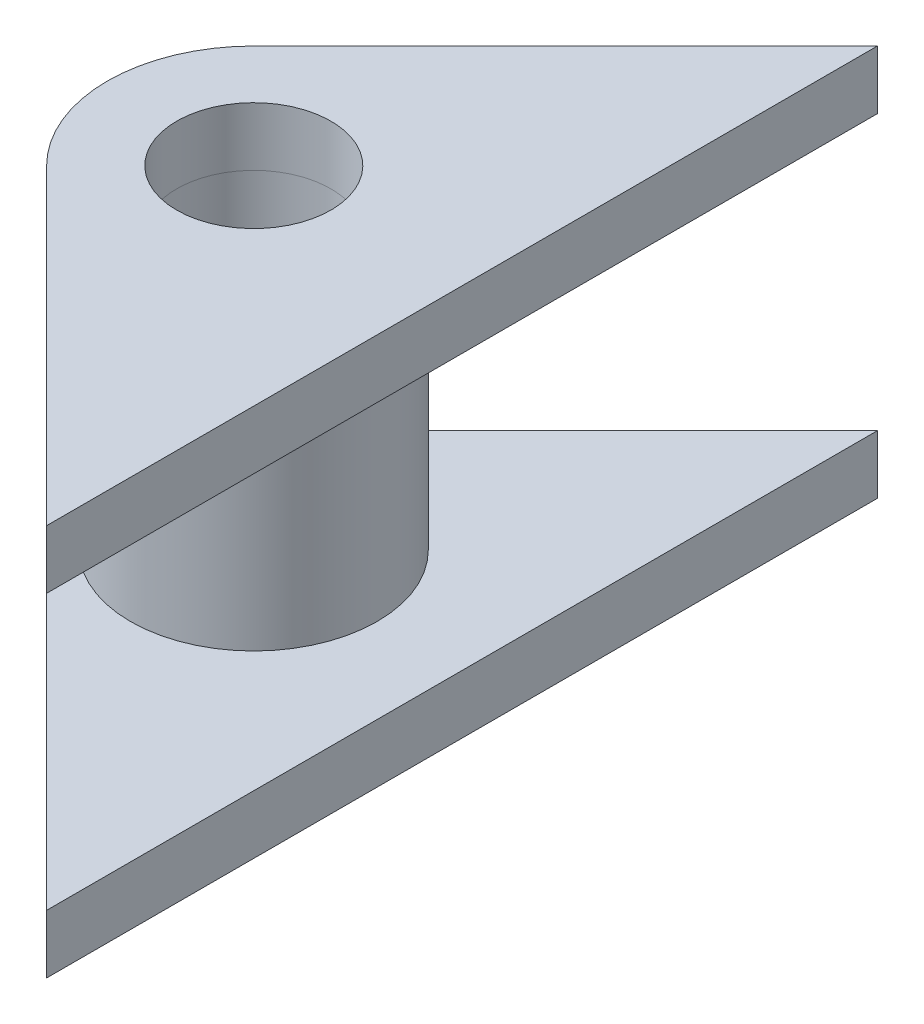
from build123d import *

# Parameters (mm, degrees)
BOSS_EXTRUDE1_START       = 12.7
SKETCH1_R                 = 5
BOSS_EXTRUDE1_DEPTH       = 3.8
BOSS_EXTRUDE2_START       = -12.7
SKETCH1_2_R               = 5
BOSS_EXTRUDE2_DEPTH       = 3.8
BOSS_EXTRUDE3_START       = -8.9
BOSS_EXTRUDE3_OUTLINE_R   = 8
BOSS_EXTRUDE3_OUTLINE_R_2 = 5
BOSS_EXTRUDE3_DEPTH       = 17.8


# Read off the part's stored shape, not the designer's step: Boss-Extrude3
with BuildPart() as part:
    # Sketch1 → Boss-Extrude1 (new body)
    with BuildSketch(Plane(origin=(0, 0, 0), x_dir=(1, 0, 0), z_dir=(0, 1, 0)).offset(BOSS_EXTRUDE1_START)):
        with BuildLine():
            Line((13.5, 26.935028843), (13.5, -26.935028843))
            Line((13.5, -26.935028843), (-6.717514421, -6.717514421))
            ThreePointArc((-6.717514421, -6.717514421), (-9.5, 0), (-6.717514421, 6.717514421))
            Line((-6.717514421, 6.717514421), (13.5, 26.935028843))
        make_face()
        with Locations(Location((0, 0, 0), (0, 0, 270))):
            Circle(SKETCH1_R, mode=Mode.SUBTRACT)
    extrude(amount=-BOSS_EXTRUDE1_DEPTH)


with BuildPart() as body_2:
    # Sketch1<2> → Boss-Extrude2 (new body)
    with BuildSketch(Plane(origin=(0, 0, 0), x_dir=(1, 0, 0), z_dir=(0, 1, 0)).offset(BOSS_EXTRUDE2_START)):
        with BuildLine():
            Line((13.5, 26.935028843), (13.5, -26.935028843))
            Line((13.5, -26.935028843), (-6.717514421, -6.717514421))
            ThreePointArc((-6.717514421, -6.717514421), (-9.5, 0), (-6.717514421, 6.717514421))
            Line((-6.717514421, 6.717514421), (13.5, 26.935028843))
        make_face()
        with Locations(Location((0, 0, 0), (0, 0, 90))):
            Circle(SKETCH1_2_R, mode=Mode.SUBTRACT)
    extrude(amount=BOSS_EXTRUDE2_DEPTH)


with BuildPart() as body_3:
    # Boss-Extrude3 outline → Boss-Extrude3 (new body)
    with BuildSketch(Plane(origin=(0, 0, 0), x_dir=(1, 0, 0), z_dir=(0, 1, 0)).offset(BOSS_EXTRUDE3_START)):
        Circle(BOSS_EXTRUDE3_OUTLINE_R)
        Circle(BOSS_EXTRUDE3_OUTLINE_R_2, mode=Mode.SUBTRACT)
    extrude(amount=BOSS_EXTRUDE3_DEPTH)


solid = Compound([part.part, body_2.part, body_3.part])
